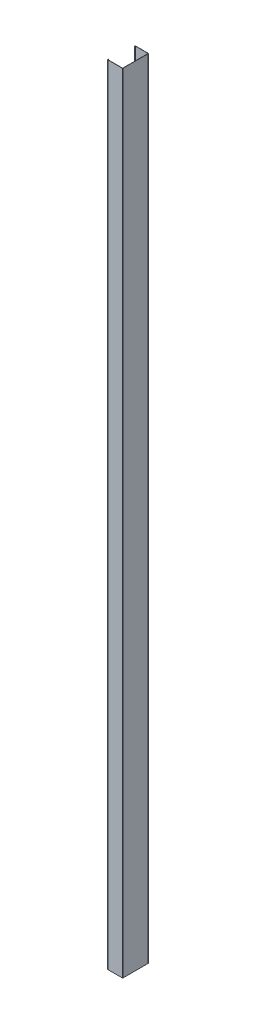
from build123d import *

# Parameters (mm, degrees)
SM_BASE_FLANGE_1_DEPTH = 3000


# Sheet-metal steps are written as plain solids
with BuildPart() as part:
    # Sketch 1 → Базовая кромка1 (new body)
    with BuildSketch(Plane(origin=(0, 0, 0), x_dir=(1, 0, 0), z_dir=(0, 1, 0))):
        with BuildLine():
            Line((-50, -3), (-50, -1.5))
            ThreePointArc((-50, -1.5), (-49.560660172, -0.439339828), (-48.5, 0))
            Line((-48.5, 0), (-1.5, 0))
            ThreePointArc((-1.5, 0), (-0.439339828, -0.439339828), (0, -1.5))
            Line((0, -1.5), (0, -97))
            ThreePointArc((0, -97), (-0.439339828, -98.060660172), (-1.5, -98.5))
            Line((-1.5, -98.5), (-56.31117163, -98.5))
            ThreePointArc((-56.31117163, -98.5), (-57.371831802, -98.060660172), (-57.81117163, -97))
            Line((-57.81117163, -97), (-57.81117163, -95.5))
            Line((-57.81117163, -95.5), (-57.06117163, -95.5))
            Line((-57.06117163, -95.5), (-57.06117163, -97))
            ThreePointArc((-57.06117163, -97), (-56.841501716, -97.530330086), (-56.31117163, -97.75))
            Line((-56.31117163, -97.75), (-1.5, -97.75))
            ThreePointArc((-1.5, -97.75), (-0.969669914, -97.530330086), (-0.75, -97))
            Line((-0.75, -97), (-0.75, -1.5))
            ThreePointArc((-0.75, -1.5), (-0.969669914, -0.969669914), (-1.5, -0.75))
            Line((-1.5, -0.75), (-48.5, -0.75))
            ThreePointArc((-48.5, -0.75), (-49.030330086, -0.969669914), (-49.25, -1.5))
            Line((-49.25, -1.5), (-49.25, -3))
            Line((-49.25, -3), (-50, -3))
        make_face()
    extrude(amount=SM_BASE_FLANGE_1_DEPTH)


solid = part.part
